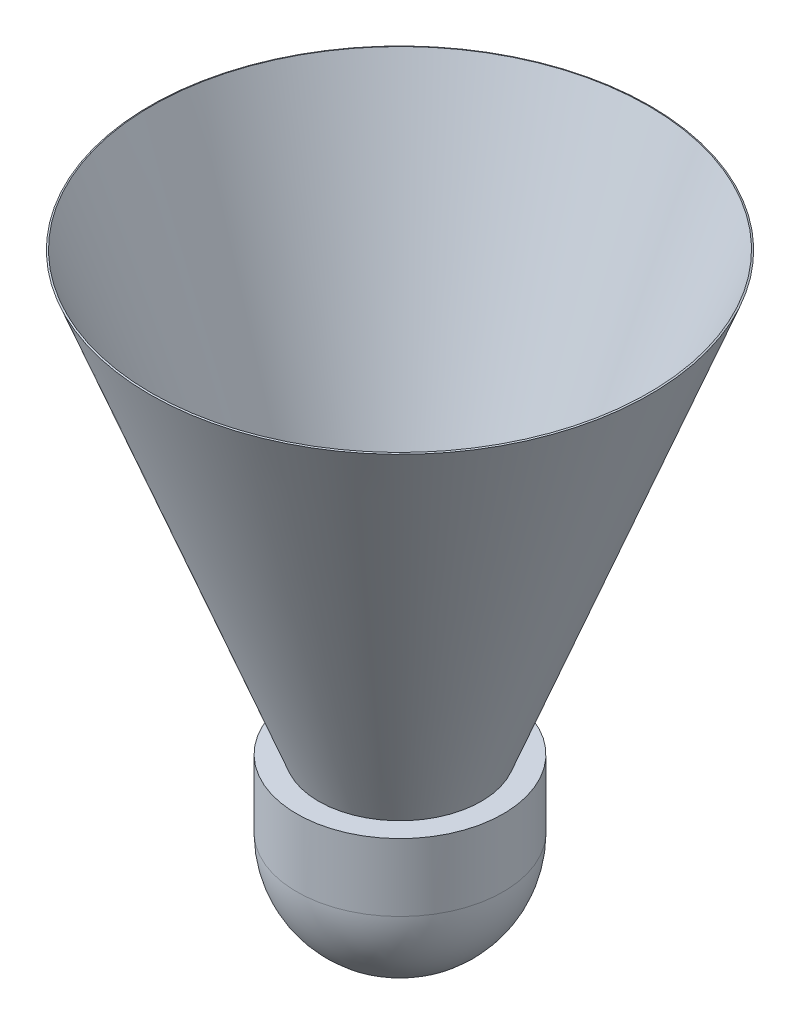
from build123d import *


with BuildPart() as part:
    # Sketch1 → Revolve1 (revolve)
    with BuildSketch(Plane.XY):
        with BuildLine():
            Line((13, 8.5), (10.25, 8.5))
            Line((10.25, 8.5), (31.5, 63.5))
            Line((31.5, 63.5), (31.313440373, 63.572079856))
            Line((31.313440373, 63.572079856), (10.035591338, 8.5))
            Line((10.035591338, 8.5), (0, 8.5))
            Line((0, 8.5), (0, -13))
            ThreePointArc((0, -13), (9.192388155, -9.192388155), (13, 0))
            Line((13, 0), (13, 8.5))
        make_face()
    revolve(axis=Axis((0, -13, 0), (0, 1, 0)))


solid = part.part
